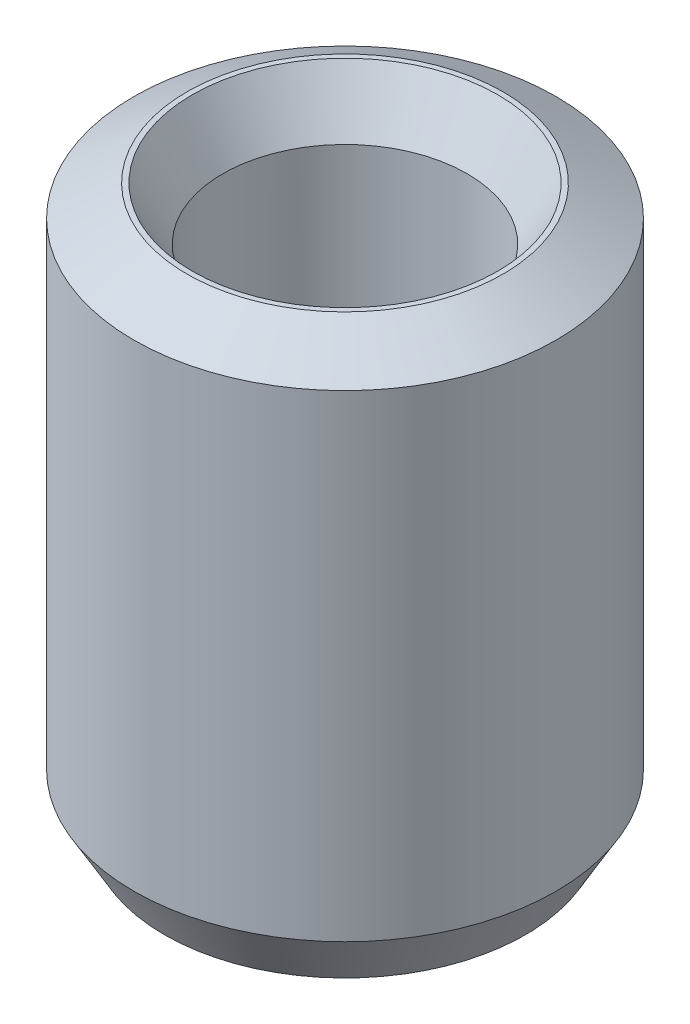
from build123d import *
from OCP.BRepFilletAPI import BRepFilletAPI_MakeChamfer

# Parameters (mm, degrees)
SKETCH1_R           = 22.5
BOSS_EXTRUDE1_DEPTH = 59.810877718
SKETCH2_R           = 13.024431894
CUT_EXTRUDE1_DEPTH  = 68.748365983
CHAMFER1_SIZE       = 3.265829284
CHAMFER1_SIZE2      = 5.656582249


with BuildPart() as part:
    # Sketch1 → Boss-Extrude1 (new body)
    with BuildSketch(Plane(origin=(0, 0, 0), x_dir=(1, 0, 0), z_dir=(0, 1, 0))):
        Circle(SKETCH1_R)
    extrude(amount=BOSS_EXTRUDE1_DEPTH)

    # Sketch2 → Cut-Extrude1 (cut, through all)
    with BuildSketch(Plane(origin=(0, 0, 0), x_dir=(1, 0, 0), z_dir=(0, 1, 0))):
        Circle(SKETCH2_R)
    extrude(amount=CUT_EXTRUDE1_DEPTH, mode=Mode.SUBTRACT)

    # Chamfer1: one chamfer whose edges measure the first distance from different faces: ONE call of the kernel's chamfer builder (chamfer() names one face for all edges)
    chamfer1_edges_1 = [part.edges().sort_by_distance(p)[0] for p in [
        (-13.024431894, 59.810877718, 0),
    ]]
    chamfer1_side_1 = [part.faces().sort_by_distance(p)[0] for p in [
        (-21.863603897, 59.810877718, 0),
    ]]
    chamfer1_edges_2 = [part.edges().sort_by_distance(p)[0] for p in [
        (-13.024431894, 0, 0),
    ]]
    chamfer1_side_2 = [part.faces().sort_by_distance(p)[0] for p in [
        (-13.024431894, 29.905438859, 0),
    ]]
    chamfer1_edges_3 = [part.edges().sort_by_distance(p)[0] for p in [
        (-22.5, 0, 0),
    ]]
    chamfer1_side_3 = [part.faces().sort_by_distance(p)[0] for p in [
        (-21.863603897, 0, 0),
    ]]
    chamfer1_edges_4 = [part.edges().sort_by_distance(p)[0] for p in [
        (-22.5, 59.810877718, 0),
    ]]
    chamfer1_side_4 = [part.faces().sort_by_distance(p)[0] for p in [
        (-22.5, 29.905438859, 0),
    ]]
    chamfer1 = BRepFilletAPI_MakeChamfer(part.part.solid().wrapped)
    for e in chamfer1_edges_1:
        chamfer1.Add(CHAMFER1_SIZE, CHAMFER1_SIZE2, e.wrapped, chamfer1_side_1[0].wrapped)  # the first distance lies on this face
    for e in chamfer1_edges_2:
        chamfer1.Add(CHAMFER1_SIZE, CHAMFER1_SIZE2, e.wrapped, chamfer1_side_2[0].wrapped)  # the first distance lies on this face
    for e in chamfer1_edges_3:
        chamfer1.Add(CHAMFER1_SIZE, CHAMFER1_SIZE2, e.wrapped, chamfer1_side_3[0].wrapped)  # the first distance lies on this face
    for e in chamfer1_edges_4:
        chamfer1.Add(CHAMFER1_SIZE, CHAMFER1_SIZE2, e.wrapped, chamfer1_side_4[0].wrapped)  # the first distance lies on this face
    add(Compound.cast(chamfer1.Shape()), mode=Mode.REPLACE)


solid = part.part
